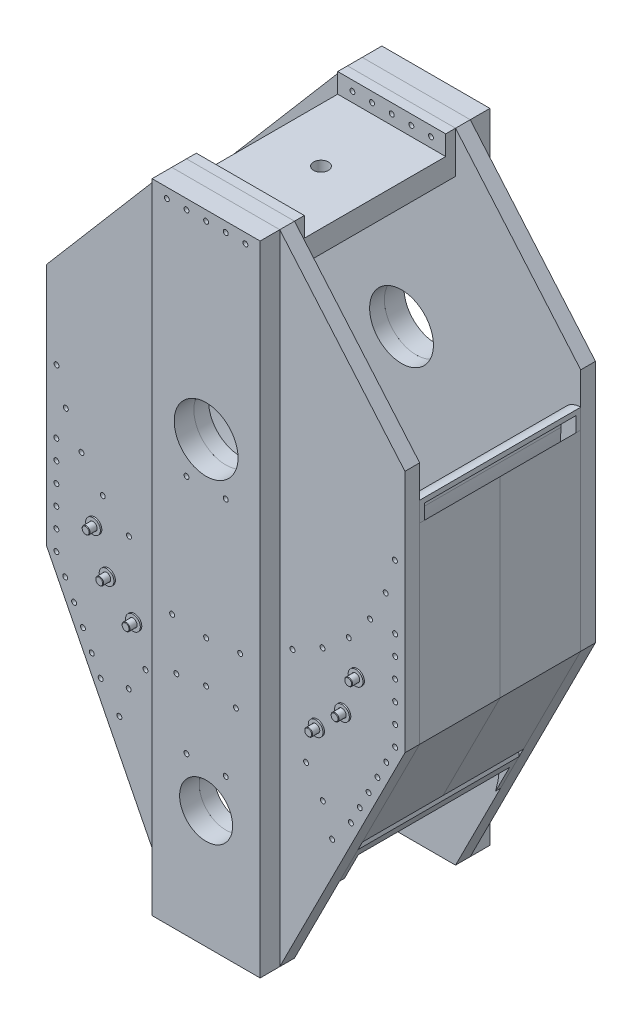
from build123d import *
from build123d.topology import SkipClean

# Parameters (mm, degrees)
PIASTRONEEXTR_DEPTH              = 30
LAMONE_DEPTH                     = 40
CARTEREXT1_START                 = 30
CARTEREXT1_DEPTH                 = 10
CARTEREXT2_START                 = 40
CARTEREXT2_DEPTH                 = 154
IRRIGIDCIRC1_START               = 30
IRRIGIDCIRC1_DEPTH               = 10
IRRIGIDCIRC2_START               = 40
IRRIGIDCIRC2_DEPTH               = 154
IRRIGIDESTERNO1_START            = 30
IRRIGIDESTERNO1_DEPTH            = 10
IRRIGIDESTERNO2_START            = 40
IRRIGIDESTERNO2_DEPTH            = 154
RINFORZOSUP1_START               = 30
SKETCH12_W                       = 110
SKETCH12_H                       = 85
RINFORZOSUP1_DEPTH               = 20
BOSS_EXTRUDE1_START              = 50
SKETCH12_4_W                     = 110
SKETCH12_4_H                     = 45
BOSS_EXTRUDE1_DEPTH              = 144
FOROCIRC3_START                  = -877.572794
SKETCH6_R                        = 5
FOROCIRC3_DEPTH                  = 1835.145587
LPATTERN11_COUNT                 = 6
LPATTERN11_PITCH                 = 40
LPATTERN21_COUNT                 = 6
LPATTERN21_PITCH                 = 40
FORIIRR_R                        = 9
FORICENTRALI_DEPTH               = 120
BUSSOLA_R                        = 18.5
BUSSOLA_R_2                      = 10.5
ROSETTA_DEPTH                    = 3
ROSETTA_2_DEPTH                  = 3
ROSETTA_3_DEPTH                  = 3
SKETCH16_R                       = 15
SKETCH16_R_2                     = 10.5
BUSSOLABODY_DEPTH                = 14
SKETCH17_R                       = 18.5
SKETCH17_R_2                     = 15.5
TUBO_DEPTH                       = 161
TUBO_2_DEPTH                     = 161
TUBO_3_DEPTH                     = 161
TIRANTE_DEPTH                    = 164
TIRANTE_DEPTH_BACK               = 48
SKETCH18_R                       = 8
TIRANTE_2_DEPTH                  = 164
TIRANTE_2_DEPTH_BACK             = 48
TIRANTE_3_DEPTH                  = 164
TIRANTE_3_DEPTH_BACK             = 48
CHAMFER1_SIZE                    = 1
CHAMFER2_SIZE                    = 1
CHAMFER3_SIZE                    = 1
SKETCH19_R                       = 15
SKETCH19_R_2                     = 8.5
ROSETTAM20_DEPTH                 = 3
ROSETTAM20_2_DEPTH               = 3
ROSETTAM20_3_DEPTH               = 3
SKETCH11_R                       = 5
FOROSUPERIORE_DEPTH              = 946.642526
LPATTERN23_COUNT                 = 3
LPATTERN23_PITCH                 = 40
LPATTERN23_COL_COUNT             = 3
LPATTERN23_COL_PITCH             = 40
FOROCIRC11_START                 = -946.642526
FORICIRC1_R                      = 5
FOROCIRC11_DEPTH                 = 1963.285051
CIRPATTERN24_COUNT               = 8
CIRPATTERN24_ANGLE               = 80
CIRPATTERN24_THE_OTHER_WAY_COUNT = 8
CIRPATTERN24_THE_OTHER_WAY_ANGLE = 80
FOROCIRC21_START                 = -946.642526
FOROCRIC2_R                      = 5
FOROCIRC21_DEPTH                 = 1973.285051
CIRPATTERN21_START               = -41
CIRPATTERN21_OUTLINE_R           = 5
CIRPATTERN21_DEPTH               = 42
CIRPATTERN21_START_2             = -1
CIRPATTERN21_2_OUTLINE_R         = 5
CIRPATTERN21_2_DEPTH             = 32
CIRPATTERN21_START_3             = 29
CIRPATTERN21_3_OUTLINE_R         = 5
CIRPATTERN21_3_DEPTH             = 11
SKETCH20_R                       = 15
CUT_EXTRUDE1_DEPTH               = 1406.122891


with BuildPart() as part:
    # Piastrone → PiastroneExtr (new body)
    with BuildSketch(Plane.XY):
        with BuildLine():
            Line((-86.205427, 491.90505), (23.794573, 491.90505))
            Line((23.794573, 491.90505), (278.794573, 193.153386))
            Line((278.794573, 193.153386), (278.794573, -303.297279))
            Line((278.794573, -303.297279), (23.794573, -808.09495))
            Line((23.794573, -808.09495), (-86.205427, -808.09495))
            Line((-86.205427, -808.09495), (-86.205427, -622.09495))
            ThreePointArc((-86.205427, -622.09495), (-32.205427, -568.09495), (-86.205427, -514.09495))
            Line((-86.205427, -514.09495), (-86.205427, 21.90505))
            ThreePointArc((-86.205427, 21.90505), (-21.205427, 86.90505), (-86.205427, 151.90505))
            Line((-86.205427, 151.90505), (-86.205427, 491.90505))
        make_face()
    extrude(amount=PIASTRONEEXTR_DEPTH)


with BuildPart() as body_2:
    # Sketch14 → Lamone (new body)
    with BuildSketch(Plane(origin=(0, 0, 0), x_dir=(-1, 0, 0), z_dir=(0, 0, -1))):
        with BuildLine():
            Line((-23.794573, 491.90505), (86.205427, 491.90505))
            Line((86.205427, 491.90505), (86.205427, 151.90505))
            ThreePointArc((86.205427, 151.90505), (21.205427, 86.90505), (86.205427, 21.90505))
            Line((86.205427, 21.90505), (86.205427, -514.09495))
            ThreePointArc((86.205427, -514.09495), (32.205427, -568.09495), (86.205427, -622.09495))
            Line((86.205427, -622.09495), (86.205427, -808.09495))
            Line((86.205427, -808.09495), (-23.794573, -808.09495))
            Line((-23.794573, -808.09495), (-23.794573, 491.90505))
        make_face()
    extrude(amount=LAMONE_DEPTH)

    # Sketch22 → Cut-Revolve1 (revolve, cut)
    with BuildSketch(Plane.ZY.offset(46.205427), mode=Mode.PRIVATE) as cut_revolve1_sk:
        Polygon((-40, -482.410436), (-40, -487.410436), (-7.113249, -487.410436), (-10, -482.410436), align=None)
    revolve(cut_revolve1_sk.sketch.rotate(Axis((-46.205427, -487.410436, -40), (0, 0, 1)), 90), axis=Axis((-46.205427, -487.410436, -40), (0, 0, 1)), mode=Mode.SUBTRACT)

    # Sketch22<3> → Cut-Revolve2 (revolve, cut)
    with BuildSketch(Plane.ZY.offset(46.205427), mode=Mode.PRIVATE) as cut_revolve2_sk:
        Polygon((-40, 6.90505), (-40, 1.90505), (-7.113249, 1.90505), (-10, 6.90505), align=None)
    revolve(cut_revolve2_sk.sketch.rotate(Axis((-46.205427, 1.90505, -40), (0, 0, 1)), 90), axis=Axis((-46.205427, 1.90505, -40), (0, 0, 1)), mode=Mode.SUBTRACT)


with BuildPart() as body_3:
    # Carter → CarterExt1 (new body)
    with BuildSketch(Plane.XY.offset(CARTEREXT1_START)):
        with BuildLine():
            ThreePointArc((248.758008, 81.955617), (255.585083, 106.603062), (278.794573, 117.346667))
            Line((278.794573, 117.346667), (278.794573, 86.90505))
            ThreePointArc((278.794573, 86.90505), (171.888548, -171.188925), (-86.205427, -278.09495))
            Line((-86.205427, -278.09495), (-86.205427, -248.09495))
            ThreePointArc((-86.205427, -248.09495), (148.918944, -151.719195), (248.758008, 81.955617))
        make_face()
        with BuildLine():
            ThreePointArc((-86.205427, -248.09495), (148.918944, -151.719195), (248.758008, 81.955617))
            ThreePointArc((248.758008, 81.955617), (255.585083, 106.603062), (278.794573, 117.346667))
            Line((278.794573, 117.346667), (278.794573, 127.247816))
            ThreePointArc((278.794573, 127.247816), (248.567893, 113.623706), (238.756849, 81.953343))
            ThreePointArc((238.756849, 81.953343), (141.846864, -144.648729), (-86.205427, -238.09495))
            Line((-86.205427, -238.09495), (-86.205427, -248.09495))
        make_face()
    extrude(amount=CARTEREXT1_DEPTH)

    # Carter<4> → CarterExt2 (add)
    with BuildSketch(Plane.XY.offset(CARTEREXT2_START)):
        with BuildLine():
            ThreePointArc((-86.205427, -248.09495), (148.918944, -151.719195), (248.758008, 81.955617))
            ThreePointArc((248.758008, 81.955617), (255.585083, 106.603062), (278.794573, 117.346667))
            Line((278.794573, 117.346667), (278.794573, 127.247816))
            ThreePointArc((278.794573, 127.247816), (248.567893, 113.623706), (238.756849, 81.953343))
            ThreePointArc((238.756849, 81.953343), (141.846864, -144.648729), (-86.205427, -238.09495))
            Line((-86.205427, -238.09495), (-86.205427, -248.09495))
        make_face()
    extrude(amount=CARTEREXT2_DEPTH)


with BuildPart() as body_4:
    # IrrigidCirc → IrrigidCirc1 (new body)
    with BuildSketch(Plane.XY.offset(IRRIGIDCIRC1_START)):
        with BuildLine():
            ThreePointArc((-86.205427, -338.09495), (77.301662, -406.337627), (143.781261, -570.569457))
            Line((143.781261, -570.569457), (115.48454, -626.58561))
            ThreePointArc((115.48454, -626.58561), (81.697876, -441.966124), (-86.205427, -358.09495))
            Line((-86.205427, -358.09495), (-86.205427, -338.09495))
        make_face()
        with BuildLine():
            ThreePointArc((-86.205427, -328.09495), (77.651834, -392.735895), (153.243359, -551.8383))
            Line((153.243359, -551.8383), (143.781261, -570.569457))
            ThreePointArc((143.781261, -570.569457), (77.301662, -406.337627), (-86.205427, -338.09495))
            Line((-86.205427, -338.09495), (-86.205427, -328.09495))
        make_face()
    extrude(amount=IRRIGIDCIRC1_DEPTH)

    # IrrigidCirc<7> → IrrigidCirc2 (add)
    with BuildSketch(Plane.XY.offset(IRRIGIDCIRC2_START)):
        with BuildLine():
            ThreePointArc((-86.205427, -328.09495), (77.651834, -392.735895), (153.243359, -551.8383))
            Line((153.243359, -551.8383), (143.781261, -570.569457))
            ThreePointArc((143.781261, -570.569457), (77.301662, -406.337627), (-86.205427, -338.09495))
            Line((-86.205427, -338.09495), (-86.205427, -328.09495))
        make_face()
    extrude(amount=IRRIGIDCIRC2_DEPTH)


with BuildPart() as body_5:
    # Sketch9 → IrrigidEsterno1 (new body)
    with BuildSketch(Plane.XY.offset(IRRIGIDESTERNO1_START)):
        with BuildLine():
            Line((238.794573, -293.767656), (278.794573, -303.297279))
            Line((278.794573, -303.297279), (278.794573, 86.90505))
            ThreePointArc((278.794573, 86.90505), (268.6537, 1.465012), (238.794573, -79.227428))
            Line((238.794573, -79.227428), (238.794573, -293.767656))
        make_face()
        with BuildLine():
            Line((162.229373, -534.049598), (278.794573, -303.297279))
            Line((278.794573, -303.297279), (238.794573, -293.767656))
            Line((238.794573, -293.767656), (146.565726, -476.343764))
            ThreePointArc((146.565726, -476.343764), (156.20169, -504.706966), (162.229373, -534.049598))
        make_face()
        with BuildLine():
            Line((146.565726, -476.343764), (238.794573, -293.767656))
            Line((238.794573, -293.767656), (228.794573, -291.385251))
            Line((228.794573, -291.385251), (141.332233, -464.525586))
            ThreePointArc((141.332233, -464.525586), (144.028552, -470.399437), (146.565726, -476.343764))
        make_face()
        with BuildLine():
            Line((228.794573, -291.385251), (238.794573, -293.767656))
            Line((238.794573, -293.767656), (238.794573, -79.227428))
            ThreePointArc((238.794573, -79.227428), (233.924769, -88.427941), (228.794573, -97.485839))
            Line((228.794573, -97.485839), (228.794573, -291.385251))
        make_face()
    extrude(amount=IRRIGIDESTERNO1_DEPTH)

    # Sketch9<3> → IrrigidEsterno2 (add)
    with BuildSketch(Plane.XY.offset(IRRIGIDESTERNO2_START)):
        with BuildLine():
            Line((278.794573, -303.297279), (162.229373, -534.049598))
            ThreePointArc((162.229373, -534.049598), (154.424767, -498.492884), (141.332233, -464.525586))
            Line((141.332233, -464.525586), (228.794573, -291.385251))
            Line((228.794573, -291.385251), (228.794573, -97.485839))
            ThreePointArc((228.794573, -97.485839), (266.072872, -8.619816), (278.794573, 86.90505))
            Line((278.794573, 86.90505), (278.794573, -303.297279))
        make_face()
    extrude(amount=IRRIGIDESTERNO2_DEPTH)


with BuildPart() as body_6:
    # Sketch12 → RinforzoSup1 (new body)
    with BuildSketch(Plane.XY.offset(RINFORZOSUP1_START)):
        with Locations((-31.205427, 449.40505)):
            Rectangle(SKETCH12_W, SKETCH12_H)
    extrude(amount=RINFORZOSUP1_DEPTH)

    # Sketch12<4> → Boss-Extrude1 (add)
    with BuildSketch(Plane.XY.offset(BOSS_EXTRUDE1_START)):
        with Locations((-31.205427, 429.40505)):
            Rectangle(SKETCH12_4_W, SKETCH12_4_H)
    extrude(amount=BOSS_EXTRUDE1_DEPTH)


with BuildPart() as forocirc3_tool:
    # Sketch6 → ForoCirc3 (new body)
    with BuildSketch(Plane.XY.offset(FOROCIRC3_START)):
        with Locations((258.794573, -303.297279)):
            Circle(SKETCH6_R)
    forocirc3 = extrude(amount=FOROCIRC3_DEPTH)


with BuildPart() as part_1:
    add(part.part)

    # ForoCirc3: cut by forocirc3_tool
    add(forocirc3_tool.part, mode=Mode.SUBTRACT)


with BuildPart() as body_5_1:
    add(body_5.part)

    # ForoCirc3: cut by forocirc3_tool
    add(forocirc3_tool.part, mode=Mode.SUBTRACT)


with BuildPart() as lpattern11_tool:
    # LPattern11: ForoCirc3 ×6
    with Locations(*[(0, i * LPATTERN11_PITCH, 0) for i in range(1, LPATTERN11_COUNT)]):
        add(forocirc3)


with BuildPart() as part_2:
    add(part_1.part)

    # LPattern11: cut by lpattern11_tool
    add(lpattern11_tool.part, mode=Mode.SUBTRACT)


with BuildPart() as body_5_2:
    add(body_5_1.part)

    # LPattern11: cut by lpattern11_tool
    add(lpattern11_tool.part, mode=Mode.SUBTRACT)


with BuildPart() as lpattern21_tool:
    # LPattern21: ForoCirc3 ×6
    with Locations(*[Vector(-0.45088930046580106, -0.8925798780644008, 0) * (i * LPATTERN21_PITCH) for i in range(1, LPATTERN21_COUNT)]):
        add(forocirc3)


with BuildPart() as part_3:
    add(part_2.part)

    # LPattern21: cut by lpattern21_tool
    add(lpattern21_tool.part, mode=Mode.SUBTRACT)

    # ForiIrr → ForiCentrali (cut)
    with BuildSketch(Plane.XY):
        with Locations(Location((99.794573, -348.09495, 0), (0, 0, 180))):
            Circle(FORIIRR_R)
        with Locations(Location((153.534688, -294.354835, 0), (0, 0, 180))):
            Circle(FORIIRR_R)
        with Locations(Location((181.196426, -218.354835, 0), (0, 0, 180))):
            Circle(FORIIRR_R)
    extrude(amount=FORICENTRALI_DEPTH, mode=Mode.SUBTRACT)


with BuildPart() as body_5_3:
    add(body_5_2.part)

    # LPattern21: cut by lpattern21_tool
    add(lpattern21_tool.part, mode=Mode.SUBTRACT)


with BuildPart() as body_7:
    # Bussola → Rosetta (new body)
    with BuildSketch(Plane.XY.offset(30)):
        with Locations((181.196426, -218.354835)):
            Circle(BUSSOLA_R)
        with Locations((181.196426, -218.354835)):
            Circle(BUSSOLA_R_2, mode=Mode.SUBTRACT)
    extrude(amount=ROSETTA_DEPTH)



with BuildPart() as body_8:
    # Bussola → Rosetta 2 (new body)
    with BuildSketch(Plane.XY.offset(30)):
        with Locations((153.534688, -294.354835)):
            Circle(BUSSOLA_R)
        with Locations((153.534688, -294.354835)):
            Circle(BUSSOLA_R_2, mode=Mode.SUBTRACT)
    extrude(amount=ROSETTA_2_DEPTH)


with BuildPart() as body_9:
    # Bussola → Rosetta 3 (new body)
    with BuildSketch(Plane.XY.offset(30)):
        with Locations((99.794573, -348.09495)):
            Circle(BUSSOLA_R)
        with Locations((99.794573, -348.09495)):
            Circle(BUSSOLA_R_2, mode=Mode.SUBTRACT)
    extrude(amount=ROSETTA_3_DEPTH)


with BuildPart() as body_7_1:
    add(body_7.part)

    add(body_8.part)  # BussolaBody merges body 8

    add(body_9.part)  # BussolaBody merges body 9
    # Sketch16 → BussolaBody (add)
    # profile 1 of 3: a face of its own
    with BuildSketch(Plane.XY.offset(33)):
        with Locations((181.196426, -218.354835)):
            Circle(SKETCH16_R)
        with Locations((181.196426, -218.354835)):
            Circle(SKETCH16_R_2, mode=Mode.SUBTRACT)
    # profile 2 of 3: a face of its own
    with BuildSketch(Plane.XY.offset(33)):
        with Locations((99.794573, -348.09495)):
            Circle(SKETCH16_R)
        with Locations((99.794573, -348.09495)):
            Circle(SKETCH16_R_2, mode=Mode.SUBTRACT)
    # profile 3 of 3: a face of its own
    with BuildSketch(Plane.XY.offset(33)):
        with Locations((153.534688, -294.354835)):
            Circle(SKETCH16_R)
        with Locations((153.534688, -294.354835)):
            Circle(SKETCH16_R_2, mode=Mode.SUBTRACT)
    extrude(amount=BUSSOLABODY_DEPTH)


with BuildPart() as body_8_2:
    # Sketch17 → Tubo (new body)
    with BuildSketch(Plane.XY.offset(33)):
        with Locations(Location((181.196426, -218.354835, 0), (0, 0, 180))):
            Circle(SKETCH17_R)
        with Locations(Location((181.196426, -218.354835, 0), (0, 0, 180))):
            Circle(SKETCH17_R_2, mode=Mode.SUBTRACT)
    extrude(amount=TUBO_DEPTH)


with BuildPart() as body_9_2:
    # Sketch17 → Tubo 2 (new body)
    with BuildSketch(Plane.XY.offset(33)):
        with Locations(Location((153.534688, -294.354835, 0), (0, 0, 180))):
            Circle(SKETCH17_R)
        with Locations(Location((153.534688, -294.354835, 0), (0, 0, 180))):
            Circle(SKETCH17_R_2, mode=Mode.SUBTRACT)
    extrude(amount=TUBO_2_DEPTH)


with BuildPart() as body_10:
    # Sketch17 → Tubo 3 (new body)
    with BuildSketch(Plane.XY.offset(33)):
        with Locations(Location((99.794573, -348.09495, 0), (0, 0, 180))):
            Circle(SKETCH17_R)
        with Locations(Location((99.794573, -348.09495, 0), (0, 0, 180))):
            Circle(SKETCH17_R_2, mode=Mode.SUBTRACT)
    extrude(amount=TUBO_3_DEPTH)


with BuildPart() as body_11:
    # Sketch18 → Tirante (new, two sides: drawn at the far end of the back side and taken through both)
    with BuildSketch(Plane.XY.offset(30).offset(-TIRANTE_DEPTH_BACK)):
        with Locations((181.196426, -218.354835)):
            Circle(SKETCH18_R)
    extrude(amount=TIRANTE_DEPTH + TIRANTE_DEPTH_BACK)

    # Chamfer1
    chamfer1_edges = [body_11.edges().sort_by_distance(p)[0] for p in [
        (173.196426, -218.354835, -18),
    ]]
    chamfer(chamfer1_edges, length=CHAMFER1_SIZE)


with BuildPart() as body_12:
    # Sketch18 → Tirante 2 (new, two sides: drawn at the far end of the back side and taken through both)
    with BuildSketch(Plane.XY.offset(30).offset(-TIRANTE_2_DEPTH_BACK)):
        with Locations((153.534688, -294.354835)):
            Circle(SKETCH18_R)
    extrude(amount=TIRANTE_2_DEPTH + TIRANTE_2_DEPTH_BACK)

    # Chamfer2
    chamfer2_edges = [body_12.edges().sort_by_distance(p)[0] for p in [
        (145.534688, -294.354835, -18),
    ]]
    chamfer(chamfer2_edges, length=CHAMFER2_SIZE)


with BuildPart() as body_13:
    # Sketch18 → Tirante 3 (new, two sides: drawn at the far end of the back side and taken through both)
    with BuildSketch(Plane.XY.offset(30).offset(-TIRANTE_3_DEPTH_BACK)):
        with Locations((99.794573, -348.09495)):
            Circle(SKETCH18_R)
    extrude(amount=TIRANTE_3_DEPTH + TIRANTE_3_DEPTH_BACK)

    # Chamfer3
    chamfer3_edges = [body_13.edges().sort_by_distance(p)[0] for p in [
        (91.794573, -348.09495, -18),
    ]]
    chamfer(chamfer3_edges, length=CHAMFER3_SIZE)


with BuildPart() as body_14:
    # Sketch19 → RosettaM20 (new body)
    with BuildSketch(Plane(origin=(0, 0, 0), x_dir=(-1, 0, 0), z_dir=(0, 0, -1))):
        with Locations((-181.196426, -218.354835)):
            Circle(SKETCH19_R)
        with Locations((-181.196426, -218.354835)):
            Circle(SKETCH19_R_2, mode=Mode.SUBTRACT)
    extrude(amount=ROSETTAM20_DEPTH)


with BuildPart() as body_15:
    # Sketch19 → RosettaM20 2 (new body)
    with BuildSketch(Plane(origin=(0, 0, 0), x_dir=(-1, 0, 0), z_dir=(0, 0, -1))):
        with Locations((-153.534688, -294.354835)):
            Circle(SKETCH19_R)
        with Locations((-153.534688, -294.354835)):
            Circle(SKETCH19_R_2, mode=Mode.SUBTRACT)
    extrude(amount=ROSETTAM20_2_DEPTH)


with BuildPart() as body_16:
    # Sketch19 → RosettaM20 3 (new body)
    with BuildSketch(Plane(origin=(0, 0, 0), x_dir=(-1, 0, 0), z_dir=(0, 0, -1))):
        with Locations((-99.794573, -348.09495)):
            Circle(SKETCH19_R)
        with Locations((-99.794573, -348.09495)):
            Circle(SKETCH19_R_2, mode=Mode.SUBTRACT)
    extrude(amount=ROSETTAM20_3_DEPTH)


with BuildPart() as body_17:
    # Mirror1: mirrored copy
    add(part_3.part.mirror(Plane(origin=(-86.205427, -514.09495, 30), x_dir=(0, 0, 1), z_dir=(1, 0, 0))))


with BuildPart() as body_18:
    # Mirror1 2: mirrored copy
    add(body_2.part.mirror(Plane(origin=(-86.205427, -514.09495, 30), x_dir=(0, 0, 1), z_dir=(1, 0, 0))))

    # LamoneBody: union body 2
    add(body_2.part)


with BuildPart() as body_19:
    # Mirror1 3: mirrored copy
    add(body_3.part.mirror(Plane(origin=(-86.205427, -514.09495, 30), x_dir=(0, 0, 1), z_dir=(1, 0, 0))))


with BuildPart() as body_20:
    # Mirror1 4: mirrored copy
    add(body_4.part.mirror(Plane(origin=(-86.205427, -514.09495, 30), x_dir=(0, 0, 1), z_dir=(1, 0, 0))))


with BuildPart() as body_21:
    # Mirror1 5: mirrored copy
    add(body_5_3.part.mirror(Plane(origin=(-86.205427, -514.09495, 30), x_dir=(0, 0, 1), z_dir=(1, 0, 0))))


with BuildPart() as body_22:
    # Mirror1 6: mirrored copy
    add(body_6.part.mirror(Plane(origin=(-86.205427, -514.09495, 30), x_dir=(0, 0, 1), z_dir=(1, 0, 0))))


with BuildPart() as body_23:
    # Mirror1 7: mirrored copy
    add(body_7_1.part.mirror(Plane(origin=(-86.205427, -514.09495, 30), x_dir=(0, 0, 1), z_dir=(1, 0, 0))))


with BuildPart() as body_24:
    # Mirror1 8: mirrored copy
    add(body_8_2.part.mirror(Plane(origin=(-86.205427, -514.09495, 30), x_dir=(0, 0, 1), z_dir=(1, 0, 0))))


with BuildPart() as body_25:
    # Mirror1 9: mirrored copy
    add(body_9_2.part.mirror(Plane(origin=(-86.205427, -514.09495, 30), x_dir=(0, 0, 1), z_dir=(1, 0, 0))))


with BuildPart() as body_26:
    # Mirror1 10: mirrored copy
    add(body_10.part.mirror(Plane(origin=(-86.205427, -514.09495, 30), x_dir=(0, 0, 1), z_dir=(1, 0, 0))))


with BuildPart() as body_27:
    # Mirror1 11: mirrored copy
    add(body_11.part.mirror(Plane(origin=(-86.205427, -514.09495, 30), x_dir=(0, 0, 1), z_dir=(1, 0, 0))))


with BuildPart() as body_28:
    # Mirror1 12: mirrored copy
    add(body_12.part.mirror(Plane(origin=(-86.205427, -514.09495, 30), x_dir=(0, 0, 1), z_dir=(1, 0, 0))))


with BuildPart() as body_29:
    # Mirror1 13: mirrored copy
    add(body_13.part.mirror(Plane(origin=(-86.205427, -514.09495, 30), x_dir=(0, 0, 1), z_dir=(1, 0, 0))))


with BuildPart() as body_30:
    # Mirror1 14: mirrored copy
    add(body_14.part.mirror(Plane(origin=(-86.205427, -514.09495, 30), x_dir=(0, 0, 1), z_dir=(1, 0, 0))))


with BuildPart() as body_31:
    # Mirror1 15: mirrored copy
    add(body_15.part.mirror(Plane(origin=(-86.205427, -514.09495, 30), x_dir=(0, 0, 1), z_dir=(1, 0, 0))))


with BuildPart() as body_32:
    # Mirror1 16: mirrored copy
    add(body_16.part.mirror(Plane(origin=(-86.205427, -514.09495, 30), x_dir=(0, 0, 1), z_dir=(1, 0, 0))))


with BuildPart() as part_4:
    add(part_3.part)

    # PiastroneBody: union body 17
    add(body_17.part)


with BuildPart() as body_4_1:
    add(body_4.part)

    # IrrCircInfBody: union body 20
    add(body_20.part)


with BuildPart() as body_3_1:
    add(body_3.part)

    # IrrCircSupBody: union body 19
    add(body_19.part)


with BuildPart() as body_6_1:
    add(body_6.part)

    # IrrSupBody: union body 22
    add(body_22.part)


with BuildPart() as forosuperiore_tool:
    # Sketch11 → ForoSuperiore (new, symmetric)
    with SkipClean():  # the faces are left unmerged after this step: merging them gives an invalid solid
        with BuildSketch(Plane.XY):
            with Locations(Location((-86.205427, 471.90505, 0), (0, 0, 180))):
                Circle(SKETCH11_R)
        forosuperiore = extrude(amount=FOROSUPERIORE_DEPTH, both=True)


with BuildPart() as part_5:
    with SkipClean():  # the faces are left unmerged after this step: merging them gives an invalid solid
        add(part_4.part)

        # ForoSuperiore: cut by forosuperiore_tool
        add(forosuperiore_tool.part, mode=Mode.SUBTRACT)


with BuildPart() as body_6_2:
    with SkipClean():  # the faces are left unmerged after this step: merging them gives an invalid solid
        add(body_6_1.part)

        # ForoSuperiore: cut by forosuperiore_tool
        add(forosuperiore_tool.part, mode=Mode.SUBTRACT)


with BuildPart() as body_18_1:
    with SkipClean():  # the faces are left unmerged after this step: merging them gives an invalid solid
        add(body_18.part)

        # ForoSuperiore: cut by forosuperiore_tool
        add(forosuperiore_tool.part, mode=Mode.SUBTRACT)


with BuildPart() as lpattern23_tool:
    # LPattern23: ForoSuperiore ×3
    with SkipClean():  # the faces are left unmerged after this step: merging them gives an invalid solid
        with Locations(*[(i * LPATTERN23_PITCH, 0, 0) for i in range(1, LPATTERN23_COUNT)]):
            add(forosuperiore)


with BuildPart() as part_6:
    with SkipClean():  # the faces are left unmerged after this step: merging them gives an invalid solid
        add(part_5.part)

        # LPattern23: cut by lpattern23_tool
        add(lpattern23_tool.part, mode=Mode.SUBTRACT)


with BuildPart() as body_6_3:
    with SkipClean():  # the faces are left unmerged after this step: merging them gives an invalid solid
        add(body_6_2.part)

        # LPattern23: cut by lpattern23_tool
        add(lpattern23_tool.part, mode=Mode.SUBTRACT)


with BuildPart() as body_18_2:
    with SkipClean():  # the faces are left unmerged after this step: merging them gives an invalid solid
        add(body_18_1.part)

        # LPattern23: cut by lpattern23_tool
        add(lpattern23_tool.part, mode=Mode.SUBTRACT)


with BuildPart() as lpattern23_col_tool:
    # LPattern23 col: ForoSuperiore ×3
    with SkipClean():  # the faces are left unmerged after this step: merging them gives an invalid solid
        with Locations(*[(-i * LPATTERN23_COL_PITCH, 0, 0) for i in range(1, LPATTERN23_COL_COUNT)]):
            add(forosuperiore)


with BuildPart() as part_7:
    with SkipClean():  # the faces are left unmerged after this step: merging them gives an invalid solid
        add(part_6.part)

        # LPattern23 col: cut by lpattern23_col_tool
        add(lpattern23_col_tool.part, mode=Mode.SUBTRACT)


with BuildPart() as body_6_4:
    with SkipClean():  # the faces are left unmerged after this step: merging them gives an invalid solid
        add(body_6_3.part)

        # LPattern23 col: cut by lpattern23_col_tool
        add(lpattern23_col_tool.part, mode=Mode.SUBTRACT)


with BuildPart() as body_18_3:
    with SkipClean():  # the faces are left unmerged after this step: merging them gives an invalid solid
        add(body_18_2.part)

        # LPattern23 col: cut by lpattern23_col_tool
        add(lpattern23_col_tool.part, mode=Mode.SUBTRACT)


with BuildPart() as forocirc11_tool:
    # ForiCirc1 → ForoCirc11 (new body)
    with SkipClean():  # the faces are left unmerged after this step: merging them gives an invalid solid
        with BuildSketch(Plane.XY.offset(FOROCIRC11_START)):
            with Locations((-86.205427, -262.971043)):
                Circle(FORICIRC1_R)
        forocirc11 = extrude(amount=FOROCIRC11_DEPTH)


with BuildPart() as part_8:
    with SkipClean():  # the faces are left unmerged after this step: merging them gives an invalid solid
        add(part_7.part)

        # ForoCirc11: cut by forocirc11_tool
        add(forocirc11_tool.part, mode=Mode.SUBTRACT)


with BuildPart() as body_3_2:
    with SkipClean():  # the faces are left unmerged after this step: merging them gives an invalid solid
        add(body_3_1.part)

        # ForoCirc11: cut by forocirc11_tool
        add(forocirc11_tool.part, mode=Mode.SUBTRACT)


with BuildPart() as body_18_4:
    with SkipClean():  # the faces are left unmerged after this step: merging them gives an invalid solid
        add(body_18_3.part)

        # ForoCirc11: cut by forocirc11_tool
        add(forocirc11_tool.part, mode=Mode.SUBTRACT)


with BuildPart() as cirpattern24_tool:
    # CirPattern24: ForoCirc11 ×8 about axis
    with SkipClean():  # the faces are left unmerged after this step: merging them gives an invalid solid
        cirpattern24_axis = Axis((-86.205427, 86.90505, 0), (0, 0, -1))
        for i in range(1, CIRPATTERN24_COUNT):
            add(forocirc11.rotate(cirpattern24_axis, i * CIRPATTERN24_ANGLE / (CIRPATTERN24_COUNT - 1)))


with BuildPart() as part_9:
    with SkipClean():  # the faces are left unmerged after this step: merging them gives an invalid solid
        add(part_8.part)

        # CirPattern24: cut by cirpattern24_tool
        add(cirpattern24_tool.part, mode=Mode.SUBTRACT)


with BuildPart() as body_3_3:
    with SkipClean():  # the faces are left unmerged after this step: merging them gives an invalid solid
        add(body_3_2.part)

        # CirPattern24: cut by cirpattern24_tool
        add(cirpattern24_tool.part, mode=Mode.SUBTRACT)


with BuildPart() as body_18_5:
    with SkipClean():  # the faces are left unmerged after this step: merging them gives an invalid solid
        add(body_18_4.part)

        # CirPattern24: cut by cirpattern24_tool
        add(cirpattern24_tool.part, mode=Mode.SUBTRACT)


with BuildPart() as cirpattern24_the_other_way_tool:
    # CirPattern24 the other way: ForoCirc11 ×8 about axis
    with SkipClean():  # the faces are left unmerged after this step: merging them gives an invalid solid
        cirpattern24_the_other_way_axis = Axis((-86.205427, 86.90505, 0), (0, 0, 1))
        for i in range(1, CIRPATTERN24_THE_OTHER_WAY_COUNT):
            add(forocirc11.rotate(cirpattern24_the_other_way_axis, i * CIRPATTERN24_THE_OTHER_WAY_ANGLE / (CIRPATTERN24_THE_OTHER_WAY_COUNT - 1)))


with BuildPart() as part_10:
    with SkipClean():  # the faces are left unmerged after this step: merging them gives an invalid solid
        add(part_9.part)

        # CirPattern24 the other way: cut by cirpattern24_the_other_way_tool
        add(cirpattern24_the_other_way_tool.part, mode=Mode.SUBTRACT)


with BuildPart() as body_3_4:
    with SkipClean():  # the faces are left unmerged after this step: merging them gives an invalid solid
        add(body_3_3.part)

        # CirPattern24 the other way: cut by cirpattern24_the_other_way_tool
        add(cirpattern24_the_other_way_tool.part, mode=Mode.SUBTRACT)


with BuildPart() as body_18_6:
    with SkipClean():  # the faces are left unmerged after this step: merging them gives an invalid solid
        add(body_18_5.part)

        # CirPattern24 the other way: cut by cirpattern24_the_other_way_tool
        add(cirpattern24_the_other_way_tool.part, mode=Mode.SUBTRACT)


with BuildPart() as forocirc21_tool:
    # ForoCric2 → ForoCirc21 (new body)
    with SkipClean():  # the faces are left unmerged after this step: merging them gives an invalid solid
        with BuildSketch(Plane.XY.offset(FOROCIRC21_START)):
            with Locations((-86.205427, -348.09495)):
                Circle(FOROCRIC2_R)
        extrude(amount=FOROCIRC21_DEPTH)


with BuildPart() as part_11:
    with SkipClean():  # the faces are left unmerged after this step: merging them gives an invalid solid
        add(part_10.part)

        # ForoCirc21: cut by forocirc21_tool
        add(forocirc21_tool.part, mode=Mode.SUBTRACT)

    # CirPattern21 2 outline → CirPattern21 2 (cut)
    with BuildSketch(Plane.XY.offset(CIRPATTERN21_START_2)):
        with Locations((130.452279, -529.892351)):
            Circle(CIRPATTERN21_2_OUTLINE_R)
        with Locations((111.529263, -471.653298)):
            Circle(CIRPATTERN21_2_OUTLINE_R)
        with Locations((77.286435, -420.886217)):
            Circle(CIRPATTERN21_2_OUTLINE_R)
        with Locations((-25.565209, -356.617377)):
            Circle(CIRPATTERN21_2_OUTLINE_R)
        with Locations((-302.863133, -529.892351)):
            Circle(CIRPATTERN21_2_OUTLINE_R)
        with Locations((-283.940117, -471.653298)):
            Circle(CIRPATTERN21_2_OUTLINE_R)
        with Locations((-249.697289, -420.886217)):
            Circle(CIRPATTERN21_2_OUTLINE_R)
        with Locations((-146.845645, -356.617377)):
            Circle(CIRPATTERN21_2_OUTLINE_R)
    extrude(amount=CIRPATTERN21_2_DEPTH, mode=Mode.SUBTRACT)


with BuildPart() as body_4_2:
    with SkipClean():  # the faces are left unmerged after this step: merging them gives an invalid solid
        add(body_4_1.part)

        # ForoCirc21: cut by forocirc21_tool
        add(forocirc21_tool.part, mode=Mode.SUBTRACT)

    # CirPattern21 3 outline → CirPattern21 3 (cut)
    with SkipClean():  # the faces are left unmerged after this step: merging them gives an invalid solid
        with BuildSketch(Plane.XY.offset(CIRPATTERN21_START_3)):
            with Locations((130.452279, -529.892351)):
                Circle(CIRPATTERN21_3_OUTLINE_R)
            with Locations((111.529263, -471.653298)):
                Circle(CIRPATTERN21_3_OUTLINE_R)
            with Locations((77.286435, -420.886217)):
                Circle(CIRPATTERN21_3_OUTLINE_R)
            with Locations((-25.565209, -356.617377)):
                Circle(CIRPATTERN21_3_OUTLINE_R)
            with Locations((-302.863133, -529.892351)):
                Circle(CIRPATTERN21_3_OUTLINE_R)
            with Locations((-283.940117, -471.653298)):
                Circle(CIRPATTERN21_3_OUTLINE_R)
            with Locations((-249.697289, -420.886217)):
                Circle(CIRPATTERN21_3_OUTLINE_R)
            with Locations((-146.845645, -356.617377)):
                Circle(CIRPATTERN21_3_OUTLINE_R)
        extrude(amount=CIRPATTERN21_3_DEPTH, mode=Mode.SUBTRACT)


with BuildPart() as body_18_7:
    with SkipClean():  # the faces are left unmerged after this step: merging them gives an invalid solid
        add(body_18_6.part)

        # ForoCirc21: cut by forocirc21_tool
        add(forocirc21_tool.part, mode=Mode.SUBTRACT)

    # CirPattern21: read off the stored shape, not the designer's step
    # CirPattern21 outline → CirPattern21 (cut)
    with SkipClean():  # the faces are left unmerged after this step: merging them gives an invalid solid
        with BuildSketch(Plane.XY.offset(CIRPATTERN21_START)):
            with Locations((-25.565209, -356.617377)):
                Circle(CIRPATTERN21_OUTLINE_R)
            with Locations((-146.845645, -356.617377)):
                Circle(CIRPATTERN21_OUTLINE_R)
        extrude(amount=CIRPATTERN21_DEPTH, mode=Mode.SUBTRACT)


with BuildPart() as body_28_2:
    # Mirror2: mirrored copy
    add(part_11.part.mirror(Plane(origin=(278.794573, 86.90505, 194), x_dir=(1, 0, 0), z_dir=(0, 0, -1))))


with BuildPart() as body_29_2:
    # Mirror2 2: mirrored copy
    add(body_3_4.part.mirror(Plane(origin=(278.794573, 86.90505, 194), x_dir=(1, 0, 0), z_dir=(0, 0, -1))))


with BuildPart() as body_30_2:
    # Mirror2 3: mirrored copy
    add(body_4_2.part.mirror(Plane(origin=(278.794573, 86.90505, 194), x_dir=(1, 0, 0), z_dir=(0, 0, -1))))

    # Combine8: union body 4
    add(body_4_2.part)


with BuildPart() as body_31_2:
    # Mirror2 4: mirrored copy
    add(body_5_3.part.mirror(Plane(origin=(278.794573, 86.90505, 194), x_dir=(1, 0, 0), z_dir=(0, 0, -1))))


with BuildPart() as body_32_2:
    # Mirror2 5: mirrored copy
    add(body_6_4.part.mirror(Plane(origin=(278.794573, 86.90505, 194), x_dir=(1, 0, 0), z_dir=(0, 0, -1))))


with BuildPart() as body_33:
    # Mirror2 6: mirrored copy
    add(body_7_1.part.mirror(Plane(origin=(278.794573, 86.90505, 194), x_dir=(1, 0, 0), z_dir=(0, 0, -1))))


with BuildPart() as body_34:
    # Mirror2 7: mirrored copy
    add(body_8_2.part.mirror(Plane(origin=(278.794573, 86.90505, 194), x_dir=(1, 0, 0), z_dir=(0, 0, -1))))


with BuildPart() as body_35:
    # Mirror2 8: mirrored copy
    add(body_9_2.part.mirror(Plane(origin=(278.794573, 86.90505, 194), x_dir=(1, 0, 0), z_dir=(0, 0, -1))))


with BuildPart() as body_36:
    # Mirror2 9: mirrored copy
    add(body_10.part.mirror(Plane(origin=(278.794573, 86.90505, 194), x_dir=(1, 0, 0), z_dir=(0, 0, -1))))


with BuildPart() as body_37:
    # Mirror2 10: mirrored copy
    add(body_11.part.mirror(Plane(origin=(278.794573, 86.90505, 194), x_dir=(1, 0, 0), z_dir=(0, 0, -1))))


with BuildPart() as body_38:
    # Mirror2 11: mirrored copy
    add(body_12.part.mirror(Plane(origin=(278.794573, 86.90505, 194), x_dir=(1, 0, 0), z_dir=(0, 0, -1))))


with BuildPart() as body_39:
    # Mirror2 12: mirrored copy
    add(body_13.part.mirror(Plane(origin=(278.794573, 86.90505, 194), x_dir=(1, 0, 0), z_dir=(0, 0, -1))))


with BuildPart() as body_40:
    # Mirror2 13: mirrored copy
    add(body_14.part.mirror(Plane(origin=(278.794573, 86.90505, 194), x_dir=(1, 0, 0), z_dir=(0, 0, -1))))


with BuildPart() as body_41:
    # Mirror2 14: mirrored copy
    add(body_15.part.mirror(Plane(origin=(278.794573, 86.90505, 194), x_dir=(1, 0, 0), z_dir=(0, 0, -1))))


with BuildPart() as body_42:
    # Mirror2 15: mirrored copy
    add(body_16.part.mirror(Plane(origin=(278.794573, 86.90505, 194), x_dir=(1, 0, 0), z_dir=(0, 0, -1))))


with BuildPart() as body_43:
    # Mirror2 16: mirrored copy
    add(body_18_7.part.mirror(Plane(origin=(278.794573, 86.90505, 194), x_dir=(1, 0, 0), z_dir=(0, 0, -1))))


with BuildPart() as body_44:
    # Mirror2 17: mirrored copy
    add(body_21.part.mirror(Plane(origin=(278.794573, 86.90505, 194), x_dir=(1, 0, 0), z_dir=(0, 0, -1))))


with BuildPart() as body_45:
    # Mirror2 18: mirrored copy
    add(body_23.part.mirror(Plane(origin=(278.794573, 86.90505, 194), x_dir=(1, 0, 0), z_dir=(0, 0, -1))))


with BuildPart() as body_46:
    # Mirror2 19: mirrored copy
    add(body_24.part.mirror(Plane(origin=(278.794573, 86.90505, 194), x_dir=(1, 0, 0), z_dir=(0, 0, -1))))


with BuildPart() as body_47:
    # Mirror2 20: mirrored copy
    add(body_25.part.mirror(Plane(origin=(278.794573, 86.90505, 194), x_dir=(1, 0, 0), z_dir=(0, 0, -1))))


with BuildPart() as body_48:
    # Mirror2 21: mirrored copy
    add(body_26.part.mirror(Plane(origin=(278.794573, 86.90505, 194), x_dir=(1, 0, 0), z_dir=(0, 0, -1))))


with BuildPart() as body_49:
    # Mirror2 22: mirrored copy
    add(body_27.part.mirror(Plane(origin=(278.794573, 86.90505, 194), x_dir=(1, 0, 0), z_dir=(0, 0, -1))))


with BuildPart() as body_50:
    # Mirror2 23: mirrored copy
    add(body_28.part.mirror(Plane(origin=(278.794573, 86.90505, 194), x_dir=(1, 0, 0), z_dir=(0, 0, -1))))


with BuildPart() as body_51:
    # Mirror2 24: mirrored copy
    add(body_29.part.mirror(Plane(origin=(278.794573, 86.90505, 194), x_dir=(1, 0, 0), z_dir=(0, 0, -1))))


with BuildPart() as body_52:
    # Mirror2 25: mirrored copy
    add(body_30.part.mirror(Plane(origin=(278.794573, 86.90505, 194), x_dir=(1, 0, 0), z_dir=(0, 0, -1))))


with BuildPart() as body_53:
    # Mirror2 26: mirrored copy
    add(body_31.part.mirror(Plane(origin=(278.794573, 86.90505, 194), x_dir=(1, 0, 0), z_dir=(0, 0, -1))))


with BuildPart() as body_54:
    # Mirror2 27: mirrored copy
    add(body_32.part.mirror(Plane(origin=(278.794573, 86.90505, 194), x_dir=(1, 0, 0), z_dir=(0, 0, -1))))


with BuildPart() as cut_extrude1_tool:
    # Sketch20 → Cut-Extrude1 (new, through all)
    with BuildSketch(Plane(origin=(0, 451.90505, 0), x_dir=(1, 0, 0), z_dir=(0, 1, 0))):
        with Locations((-86.205427, -194)):
            Circle(SKETCH20_R)
    extrude(amount=-CUT_EXTRUDE1_DEPTH)


with BuildPart() as body_6_5:
    add(body_6_4.part)

    # Cut-Extrude1: cut by cut_extrude1_tool
    add(cut_extrude1_tool.part, mode=Mode.SUBTRACT)


with BuildPart() as body_32_2_1:
    add(body_32_2.part)

    # Cut-Extrude1: cut by cut_extrude1_tool
    add(cut_extrude1_tool.part, mode=Mode.SUBTRACT)


with BuildPart() as body_6_6:
    add(body_6_5.part)

    # Combine6: union body 32 2
    add(body_32_2_1.part)


with BuildPart() as body_3_5:
    add(body_3_4.part)

    # Combine9: union body 29 2
    add(body_29_2.part)


solid = Compound([body_5_3.part, body_7_1.part, body_8_2.part, body_9_2.part, body_10.part, body_11.part, body_12.part, body_13.part, body_14.part, body_15.part, body_16.part, body_21.part, body_23.part, body_24.part, body_25.part, body_26.part, body_27.part, body_28.part, body_29.part, body_30.part, body_31.part, body_32.part, part_11.part, body_18_7.part, body_28_2.part, body_30_2.part, body_31_2.part, body_33.part, body_34.part, body_35.part, body_36.part, body_37.part, body_38.part, body_39.part, body_40.part, body_41.part, body_42.part, body_43.part, body_44.part, body_45.part, body_46.part, body_47.part, body_48.part, body_49.part, body_50.part, body_51.part, body_52.part, body_53.part, body_54.part, body_6_6.part, body_3_5.part])
